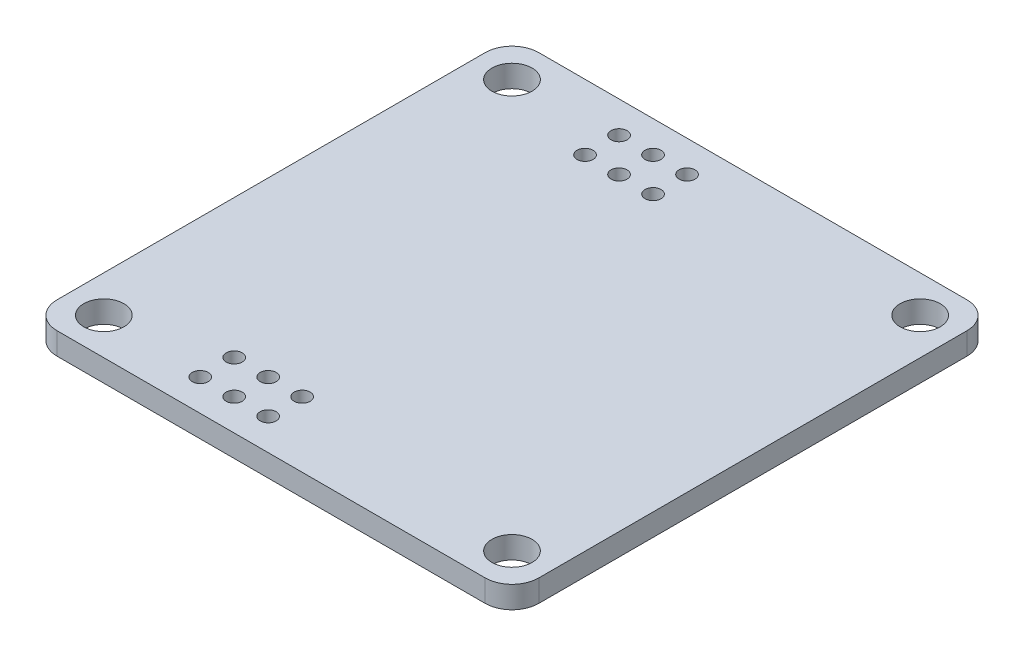
from build123d import *

# Parameters (mm, degrees)
SKETCH1_W             = 36
SKETCH1_H             = 36
SKETCH1_R             = 1.5
BASE_SHAPE_DEPTH      = 1.65
ROUNDED_CORNERS_R     = 2
PINHEADER_HOLES_REACH = 27.509
SKETCH2_R             = 0.6


with BuildPart() as part:
    # Sketch1 → Base shape (new body)
    with BuildSketch(Plane(origin=(0, 0, 0), x_dir=(1, 0, 0), z_dir=(0, 1, 0))):
        Rectangle(SKETCH1_W, SKETCH1_H)
        with Locations((-15.25, 15.25)):
            Circle(SKETCH1_R, mode=Mode.SUBTRACT)
        with Locations((15.25, 15.25)):
            Circle(SKETCH1_R, mode=Mode.SUBTRACT)
        with Locations((15.25, -15.25)):
            Circle(SKETCH1_R, mode=Mode.SUBTRACT)
        with Locations((-15.25, -15.25)):
            Circle(SKETCH1_R, mode=Mode.SUBTRACT)
    extrude(amount=BASE_SHAPE_DEPTH)

    # Rounded corners
    rounded_corners_edges = [part.edges().sort_by_distance(p)[0] for p in [
        (-18, 0.825, -18),
        (18, 0.825, -18),
        (18, 0.825, 18),
        (-18, 0.825, 18),
    ]]
    fillet(rounded_corners_edges, radius=ROUNDED_CORNERS_R)

    # Sketch2 → Pinheader holes (cut, up to next)
    with BuildSketch(Plane(origin=(0, 1.65, 0), x_dir=(1, 0, 0), z_dir=(0, 1, 0)), mode=Mode.PRIVATE) as pinheader_holes_sk1:
        with Locations((-5.11, 15.65)):
            Circle(SKETCH2_R)
    pinheader_holes_tool1 = extrude(pinheader_holes_sk1.sketch, amount=-PINHEADER_HOLES_REACH, mode=Mode.PRIVATE) & part.part
    # Sketch2 → Pinheader holes (cut, up to next)
    with BuildSketch(Plane(origin=(0, 1.65, 0), x_dir=(1, 0, 0), z_dir=(0, 1, 0)), mode=Mode.PRIVATE) as pinheader_holes_sk2:
        with Locations((-7.65, 15.65)):
            Circle(SKETCH2_R)
    pinheader_holes_tool2 = extrude(pinheader_holes_sk2.sketch, amount=-PINHEADER_HOLES_REACH, mode=Mode.PRIVATE) & part.part
    # Sketch2 → Pinheader holes (cut, up to next)
    with BuildSketch(Plane(origin=(0, 1.65, 0), x_dir=(1, 0, 0), z_dir=(0, 1, 0)), mode=Mode.PRIVATE) as pinheader_holes_sk3:
        with Locations((-2.57, 15.65)):
            Circle(SKETCH2_R)
    pinheader_holes_tool3 = extrude(pinheader_holes_sk3.sketch, amount=-PINHEADER_HOLES_REACH, mode=Mode.PRIVATE) & part.part
    # Sketch2 → Pinheader holes (cut, up to next)
    with BuildSketch(Plane(origin=(0, 1.65, 0), x_dir=(1, 0, 0), z_dir=(0, 1, 0)), mode=Mode.PRIVATE) as pinheader_holes_sk4:
        with Locations((-5.11, 13.11)):
            Circle(SKETCH2_R)
    pinheader_holes_tool4 = extrude(pinheader_holes_sk4.sketch, amount=-PINHEADER_HOLES_REACH, mode=Mode.PRIVATE) & part.part
    # Sketch2 → Pinheader holes (cut, up to next)
    with BuildSketch(Plane(origin=(0, 1.65, 0), x_dir=(1, 0, 0), z_dir=(0, 1, 0)), mode=Mode.PRIVATE) as pinheader_holes_sk5:
        with Locations((-2.57, 13.11)):
            Circle(SKETCH2_R)
    pinheader_holes_tool5 = extrude(pinheader_holes_sk5.sketch, amount=-PINHEADER_HOLES_REACH, mode=Mode.PRIVATE) & part.part
    # Sketch2 → Pinheader holes (cut, up to next)
    with BuildSketch(Plane(origin=(0, 1.65, 0), x_dir=(1, 0, 0), z_dir=(0, 1, 0)), mode=Mode.PRIVATE) as pinheader_holes_sk6:
        with Locations((-7.65, 13.11)):
            Circle(SKETCH2_R)
    pinheader_holes_tool6 = extrude(pinheader_holes_sk6.sketch, amount=-PINHEADER_HOLES_REACH, mode=Mode.PRIVATE) & part.part
    # Sketch2 → Pinheader holes (cut, up to next)
    with BuildSketch(Plane(origin=(0, 1.65, 0), x_dir=(1, 0, 0), z_dir=(0, 1, 0)), mode=Mode.PRIVATE) as pinheader_holes_sk7:
        with Locations((-2.57, -13.11)):
            Circle(SKETCH2_R)
    pinheader_holes_tool7 = extrude(pinheader_holes_sk7.sketch, amount=-PINHEADER_HOLES_REACH, mode=Mode.PRIVATE) & part.part
    # Sketch2 → Pinheader holes (cut, up to next)
    with BuildSketch(Plane(origin=(0, 1.65, 0), x_dir=(1, 0, 0), z_dir=(0, 1, 0)), mode=Mode.PRIVATE) as pinheader_holes_sk8:
        with Locations((-2.57, -15.65)):
            Circle(SKETCH2_R)
    pinheader_holes_tool8 = extrude(pinheader_holes_sk8.sketch, amount=-PINHEADER_HOLES_REACH, mode=Mode.PRIVATE) & part.part
    # Sketch2 → Pinheader holes (cut, up to next)
    with BuildSketch(Plane(origin=(0, 1.65, 0), x_dir=(1, 0, 0), z_dir=(0, 1, 0)), mode=Mode.PRIVATE) as pinheader_holes_sk9:
        with Locations((-5.11, -13.11)):
            Circle(SKETCH2_R)
    pinheader_holes_tool9 = extrude(pinheader_holes_sk9.sketch, amount=-PINHEADER_HOLES_REACH, mode=Mode.PRIVATE) & part.part
    # Sketch2 → Pinheader holes (cut, up to next)
    with BuildSketch(Plane(origin=(0, 1.65, 0), x_dir=(1, 0, 0), z_dir=(0, 1, 0)), mode=Mode.PRIVATE) as pinheader_holes_sk10:
        with Locations((-5.11, -15.65)):
            Circle(SKETCH2_R)
    pinheader_holes_tool10 = extrude(pinheader_holes_sk10.sketch, amount=-PINHEADER_HOLES_REACH, mode=Mode.PRIVATE) & part.part
    # Sketch2 → Pinheader holes (cut, up to next)
    with BuildSketch(Plane(origin=(0, 1.65, 0), x_dir=(1, 0, 0), z_dir=(0, 1, 0)), mode=Mode.PRIVATE) as pinheader_holes_sk11:
        with Locations((-7.65, -13.11)):
            Circle(SKETCH2_R)
    pinheader_holes_tool11 = extrude(pinheader_holes_sk11.sketch, amount=-PINHEADER_HOLES_REACH, mode=Mode.PRIVATE) & part.part
    # Sketch2 → Pinheader holes (cut, up to next)
    with BuildSketch(Plane(origin=(0, 1.65, 0), x_dir=(1, 0, 0), z_dir=(0, 1, 0)), mode=Mode.PRIVATE) as pinheader_holes_sk12:
        with Locations((-7.65, -15.65)):
            Circle(SKETCH2_R)
    pinheader_holes_tool12 = extrude(pinheader_holes_sk12.sketch, amount=-PINHEADER_HOLES_REACH, mode=Mode.PRIVATE) & part.part
    add(pinheader_holes_tool1.solids().sort_by_distance((-5.11, 1.65, -15.65))[0], mode=Mode.SUBTRACT)
    add(pinheader_holes_tool2.solids().sort_by_distance((-7.65, 1.65, -15.65))[0], mode=Mode.SUBTRACT)
    add(pinheader_holes_tool3.solids().sort_by_distance((-2.57, 1.65, -15.65))[0], mode=Mode.SUBTRACT)
    add(pinheader_holes_tool4.solids().sort_by_distance((-5.11, 1.65, -13.11))[0], mode=Mode.SUBTRACT)
    add(pinheader_holes_tool5.solids().sort_by_distance((-2.57, 1.65, -13.11))[0], mode=Mode.SUBTRACT)
    add(pinheader_holes_tool6.solids().sort_by_distance((-7.65, 1.65, -13.11))[0], mode=Mode.SUBTRACT)
    add(pinheader_holes_tool7.solids().sort_by_distance((-2.57, 1.65, 13.11))[0], mode=Mode.SUBTRACT)
    add(pinheader_holes_tool8.solids().sort_by_distance((-2.57, 1.65, 15.65))[0], mode=Mode.SUBTRACT)
    add(pinheader_holes_tool9.solids().sort_by_distance((-5.11, 1.65, 13.11))[0], mode=Mode.SUBTRACT)
    add(pinheader_holes_tool10.solids().sort_by_distance((-5.11, 1.65, 15.65))[0], mode=Mode.SUBTRACT)
    add(pinheader_holes_tool11.solids().sort_by_distance((-7.65, 1.65, 13.11))[0], mode=Mode.SUBTRACT)
    add(pinheader_holes_tool12.solids().sort_by_distance((-7.65, 1.65, 15.65))[0], mode=Mode.SUBTRACT)


solid = part.part
